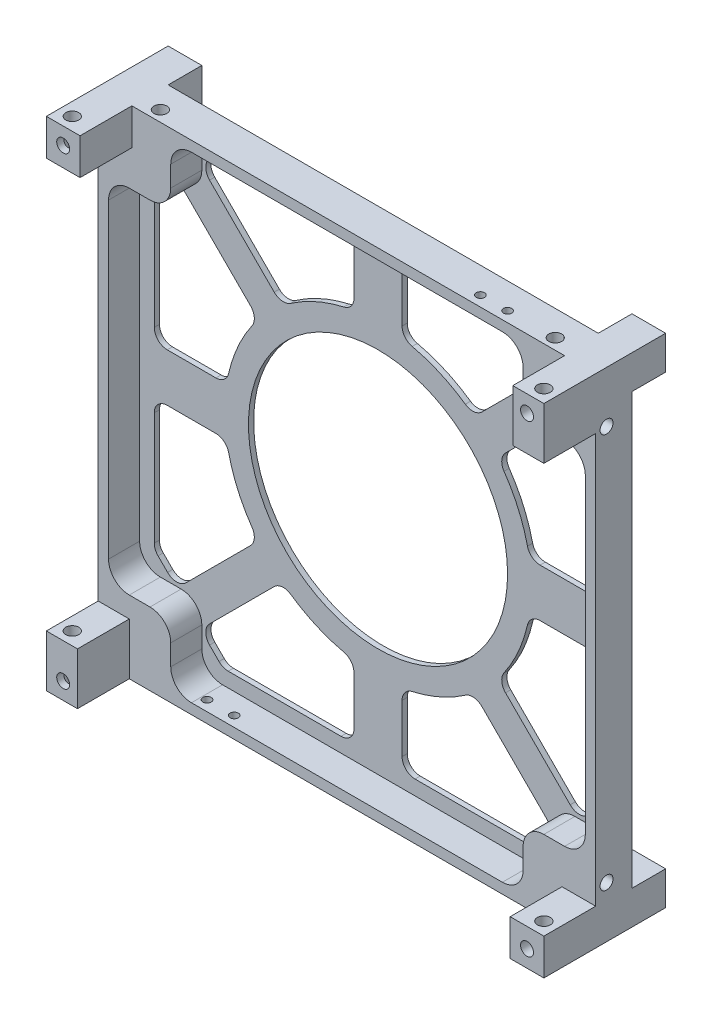
from build123d import *

# Parameters (mm, degrees)
BOSS_EXTRUDE2_DEPTH               = 1
CIRPATTERN3_COUNT                 = 4
SKETCH2_W                         = 6.5
SKETCH2_H                         = 6.5
BOSS_EXTRUDE3_DEPTH               = 6.5
SKETCH4_W                         = 96
SKETCH4_H                         = 96
BOSS_EXTRUDE4_DEPTH               = 6
SKETCH5_W                         = 6.5
SKETCH5_H                         = 7
SKETCH5_W_2                       = 6
SKETCH5_H_2                       = 10
BOSS_EXTRUDE5_DEPTH               = 10
M3_TAPPED_RAILHOLES_AT_2_COUNT    = 2
M3_TAPPED_RAILHOLES_AT_2_PITCH    = 91
SIDEPLATEHOLES_COUNT              = 4
M2X0_4_TAPPED_HOLE1_AT_2_COUNT    = 2
M2X0_4_TAPPED_HOLE1_AT_2_PITCH    = 5.25
LIMITSWITCHHOLES_COUNT            = 2
FILLET2_R                         = 4
M3_TAPPED_STANDOFF_HOLE_D         = 2.5
STANDOFFHOLES_COUNT               = 4
SKETCH26_R                        = 1.7
BOSS_EXTRUDE6_DEPTH               = 3
M1_6X0_35_TAPPED_HOLE1_AT_2_COUNT = 2
M1_6X0_35_TAPPED_HOLE1_AT_2_PITCH = 75


with BuildPart() as part:
    # Sketch3 → Boss-Extrude2 (new body)
    with BuildSketch(Plane.XY):
        with BuildLine():
            Line((48, 48), (0, 48))
            Line((0, 48), (0, 25))
            ThreePointArc((0, 25), (17.67766953, 17.67766953), (25, 0))
            Line((25, 0), (48, 0))
            Line((48, 0), (48, 48))
        make_face()
        with BuildLine():
            Line((4.64, 40.68), (4.64, 31.275338527))
            ThreePointArc((4.64, 31.275338527), (5.185383207, 29.716661783), (6.583578554, 28.838045936))
            ThreePointArc((6.583578554, 28.838045936), (11.929970388, 27.067548957), (16.843891651, 24.31583258))
            ThreePointArc((16.843891651, 24.31583258), (18.491652526, 23.880994223), (20.035246471, 24.603156278))
            Line((20.035246471, 24.603156278), (32.512233047, 37.080142853))
            ThreePointArc((32.512233047, 37.080142853), (33.244466094, 38.847909806), (32.512233047, 40.615676759))
            Line((32.512233047, 40.615676759), (30.680142853, 42.447766953))
            ThreePointArc((30.680142853, 42.447766953), (29.869084481, 42.989698831), (28.912375901, 43.18))
            Line((28.912375901, 43.18), (7.14, 43.18))
            ThreePointArc((7.14, 43.18), (5.372233047, 42.447766953), (4.64, 40.68))
        make_face(mode=Mode.SUBTRACT)
        with BuildLine():
            Line((24.603156278, 20.035246471), (37.080142853, 32.512233047))
            ThreePointArc((37.080142853, 32.512233047), (38.847909806, 33.244466094), (40.615676759, 32.512233047))
            Line((40.615676759, 32.512233047), (42.447766953, 30.680142853))
            ThreePointArc((42.447766953, 30.680142853), (42.989698831, 29.869084481), (43.18, 28.912375901))
            Line((43.18, 28.912375901), (43.18, 7.14))
            ThreePointArc((43.18, 7.14), (42.447766953, 5.372233047), (40.68, 4.64))
            Line((40.68, 4.64), (31.275338527, 4.64))
            ThreePointArc((31.275338527, 4.64), (29.716661783, 5.185383207), (28.838045936, 6.583578554))
            ThreePointArc((28.838045936, 6.583578554), (27.067548957, 11.929970388), (24.31583258, 16.843891651))
            ThreePointArc((24.31583258, 16.843891651), (23.880994223, 18.491652526), (24.603156278, 20.035246471))
        make_face(mode=Mode.SUBTRACT)
    boss_extrude2 = extrude(amount=BOSS_EXTRUDE2_DEPTH)

    # CirPattern3: Boss-Extrude2 ×4 about axis
    cirpattern3_axis = Axis((0, 0, 7.875), (0, 0, -1))
    for i in range(1, CIRPATTERN3_COUNT):
        add(boss_extrude2.rotate(cirpattern3_axis, i * 360 / CIRPATTERN3_COUNT))

    # Sketch2 → Boss-Extrude3 (add)
    with BuildSketch(Plane.XY):
        with Locations((44.75, 44.75)):
            Rectangle(SKETCH2_W, SKETCH2_H)
        with Locations((44.75, -44.75)):
            Rectangle(SKETCH2_W, SKETCH2_H)
        with Locations((-44.75, -44.75)):
            Rectangle(SKETCH2_W, SKETCH2_H)
        with Locations((-44.75, 44.75)):
            Rectangle(SKETCH2_W, SKETCH2_H)
    extrude(amount=-BOSS_EXTRUDE3_DEPTH)

    # Sketch4 → Boss-Extrude4 (add)
    with BuildSketch(Plane.XY.offset(1)):
        Rectangle(SKETCH4_W, SKETCH4_H)
        Polygon((46, -34), (46, 34), (34, 34), (34, 46), (-34, 46), (-34, 34), (-46, 34), (-46, -34), (-34, -34), (-34, -46), (34, -46), (34, -34), align=None, mode=Mode.SUBTRACT)
    extrude(amount=BOSS_EXTRUDE4_DEPTH)

    # Sketch5 → Boss-Extrude5 (add)
    with BuildSketch(Plane.XY.offset(7)):
        with Locations((-44.75, 44.5)):
            Rectangle(SKETCH5_W, SKETCH5_H)
        with Locations((45, 43)):
            Rectangle(SKETCH5_W_2, SKETCH5_H_2)
        with Locations((-45, -43)):
            Rectangle(SKETCH5_W_2, SKETCH5_H_2)
        with Locations((44.75, -44.5)):
            Rectangle(SKETCH5_W, SKETCH5_H)
    extrude(amount=BOSS_EXTRUDE5_DEPTH)

    # Sketch13 → M3 Tapped RailHoles (revolve, cut)
    with BuildSketch(Plane(origin=(45.5, 48, 14.5), x_dir=(0, 0, 1), z_dir=(1, 0, 0))):
        Polygon((0, 0), (0, 13.251075774), (1.25, 12.5), (1.25, 0), align=None)
    m3_tapped_railholes = revolve(axis=Axis((45.5, 54.35, 14.5), (0, -1, 0)), mode=Mode.SUBTRACT)

    # M3 Tapped RailHoles at 2: M3 Tapped RailHoles ×2
    with Locations(*[(-i * M3_TAPPED_RAILHOLES_AT_2_PITCH, 0, 0) for i in range(1, M3_TAPPED_RAILHOLES_AT_2_COUNT)]):
        add(m3_tapped_railholes, mode=Mode.SUBTRACT)

    # RailHoles: M3 Tapped RailHoles across plane
    add(m3_tapped_railholes.mirror(Plane.ZX), mode=Mode.SUBTRACT)

    # RailHoles copy 1 sketch → RailHoles copy 1 (revolve, cut)
    with BuildSketch(Plane(origin=(-45.5, -48, 14.5), x_dir=(0, 0, 1), z_dir=(1, 0, 0))):
        Polygon((0, 0), (0, -13.251075774), (1.25, -12.5), (1.25, 0), align=None)
    revolve(axis=Axis((-45.5, -54.35, 14.5), (0, -1, 0)), mode=Mode.SUBTRACT)

    # Sketch17 → M3x0.5 Tapped SidePlate (revolve, cut)
    with BuildSketch(Plane(origin=(-38.1, -48, 4.9), x_dir=(0, 0, -1), z_dir=(1, 0, 0))):
        Polygon((0, 0), (0, 8.251075774), (1.25, 7.5), (1.25, 0), align=None)
    m3x0_5_tapped_sideplate = revolve(axis=Axis((-38.1, -54.35, 4.9), (0, 1, 0)), mode=Mode.SUBTRACT)

    # Sketch19 → M3x0.5 Tapped SidePlate2 (revolve, cut)
    with BuildSketch(Plane(origin=(-48, -38.1, 4.9), x_dir=(0, 0, 1), z_dir=(0, 1, 0))):
        Polygon((0, 0), (0, 8.251075774), (1.25, 7.5), (1.25, 0), align=None)
    m3x0_5_tapped_sideplate2 = revolve(axis=Axis((-54.35, -38.1, 4.9), (1, 0, 0)), mode=Mode.SUBTRACT)

    # SidePlateHoles: M3x0.5 Tapped SidePlate, M3x0.5 Tapped SidePlate2 ×4 about axis
    sideplateholes_axis = Axis((0, 0, 1), (0, 0, -1))
    add([m3x0_5_tapped_sideplate.rotate(sideplateholes_axis, i * 360 / SIDEPLATEHOLES_COUNT) for i in range(1, SIDEPLATEHOLES_COUNT)], mode=Mode.SUBTRACT)
    add([m3x0_5_tapped_sideplate2.rotate(sideplateholes_axis, i * 360 / SIDEPLATEHOLES_COUNT) for i in range(1, SIDEPLATEHOLES_COUNT)], mode=Mode.SUBTRACT)

    # Sketch21 → M2x0.4 Tapped Hole1 (revolve, cut)
    with BuildSketch(Plane(origin=(-29, -48, 5), x_dir=(0, 0, -1), z_dir=(1, 0, 0))):
        Polygon((0, 0), (0, 5.680688495), (0.8, 5.2), (0.8, 0), align=None)
    m2x0_4_tapped_hole1 = revolve(axis=Axis((-29, -54.35, 5), (0, 1, 0)), mode=Mode.SUBTRACT)

    # M2x0.4 Tapped Hole1 at 2: M2x0.4 Tapped Hole1 ×2
    with Locations(*[(i * M2X0_4_TAPPED_HOLE1_AT_2_PITCH, 0, 0) for i in range(1, M2X0_4_TAPPED_HOLE1_AT_2_COUNT)]):
        add(m2x0_4_tapped_hole1, mode=Mode.SUBTRACT)

    # LimitSwitchHoles: M2x0.4 Tapped Hole1 ×2 about axis
    limitswitchholes_axis = Axis((0, 0, 1), (0, 0, -1))
    for i in range(1, LIMITSWITCHHOLES_COUNT):
        add(m2x0_4_tapped_hole1.rotate(limitswitchholes_axis, i * 360 / LIMITSWITCHHOLES_COUNT), mode=Mode.SUBTRACT)

    # LimitSwitchHoles copy 1 sketch → LimitSwitchHoles copy 1 (revolve, cut)
    with BuildSketch(Plane(origin=(23.75, 48, 5), x_dir=(0, 0, -1), z_dir=(-1, 0, 0))):
        Polygon((0, 0), (0, 5.680688495), (0.8, 5.2), (0.8, 0), align=None)
    revolve(axis=Axis((23.75, 54.35, 5), (0, -1, 0)), mode=Mode.SUBTRACT)

    # Fillet2
    fillet2_edges = [part.edges().sort_by_distance(p)[0] for p in [
        (-46, -34, 4),
        (-34, -34, 4),
        (-34, -46, 4),
        (34, -46, 4),
        (34, -34, 4),
        (46, -34, 4),
        (46, 34, 4),
        (34, 34, 4),
        (34, 46, 4),
        (-34, 46, 4),
        (-34, 34, 4),
        (-46, 34, 4),
    ]]
    fillet(fillet2_edges, radius=FILLET2_R)

    # M3 Tapped Standoff Hole (through all)
    with Locations(Plane.XY.offset(17)):
        with Locations((44.75, 44.75)):
            m3_tapped_standoff_hole = Hole(M3_TAPPED_STANDOFF_HOLE_D / 2)

    # StandoffHoles: M3 Tapped Standoff Hole ×4 about axis
    standoffholes_axis = Axis((0, 0, 1), (0, 0, -1))
    for i in range(1, STANDOFFHOLES_COUNT):
        add(m3_tapped_standoff_hole.rotate(standoffholes_axis, i * 360 / STANDOFFHOLES_COUNT), mode=Mode.SUBTRACT)

    # Sketch26 → Boss-Extrude6 (add)
    with BuildSketch(Plane(origin=(0, 0, 0), x_dir=(-1, 0, 0), z_dir=(0, 0, -1))):
        with Locations((40, -37.5)):
            Circle(SKETCH26_R)
        with Locations((40, 37.5)):
            Circle(SKETCH26_R)
    boss_extrude6 = extrude(amount=BOSS_EXTRUDE6_DEPTH)

    # Sketch31 → M1.6x0.35 Tapped Hole1 (revolve, cut)
    with BuildSketch(Plane(origin=(-40, -37.5, -3), x_dir=(0, 1, 0), z_dir=(1, 0, 0))):
        Polygon((0, 0), (0, 3.375537887), (0.625, 3), (0.625, 0), align=None)
    m1_6x0_35_tapped_hole1 = revolve(axis=Axis((-40, -37.5, -9.35), (0, 0, 1)), mode=Mode.SUBTRACT)

    # M1.6x0.35 Tapped Hole1 at 2: M1.6x0.35 Tapped Hole1 ×2
    with Locations(*[(0, i * M1_6X0_35_TAPPED_HOLE1_AT_2_PITCH, 0) for i in range(1, M1_6X0_35_TAPPED_HOLE1_AT_2_COUNT)]):
        add(m1_6x0_35_tapped_hole1, mode=Mode.SUBTRACT)

    # BottomHoles: Boss-Extrude6, M1.6x0.35 Tapped Hole1 across plane
    add(boss_extrude6.mirror(Plane(origin=(0, 0, 0), x_dir=(0, 0, 1), z_dir=(1, 0, 0))))
    add(m1_6x0_35_tapped_hole1.mirror(Plane(origin=(0, 0, 0), x_dir=(0, 0, 1), z_dir=(1, 0, 0))), mode=Mode.SUBTRACT)

    # BottomHoles copy 1 sketch → BottomHoles copy 1 (revolve, cut)
    with BuildSketch(Plane(origin=(40, 37.5, -3), x_dir=(0, 1, 0), z_dir=(-1, 0, 0))):
        Polygon((0, 0), (0, -3.375537887), (0.625, -3), (0.625, 0), align=None)
    revolve(axis=Axis((40, 37.5, -9.35), (0, 0, -1)), mode=Mode.SUBTRACT)


solid = part.part
